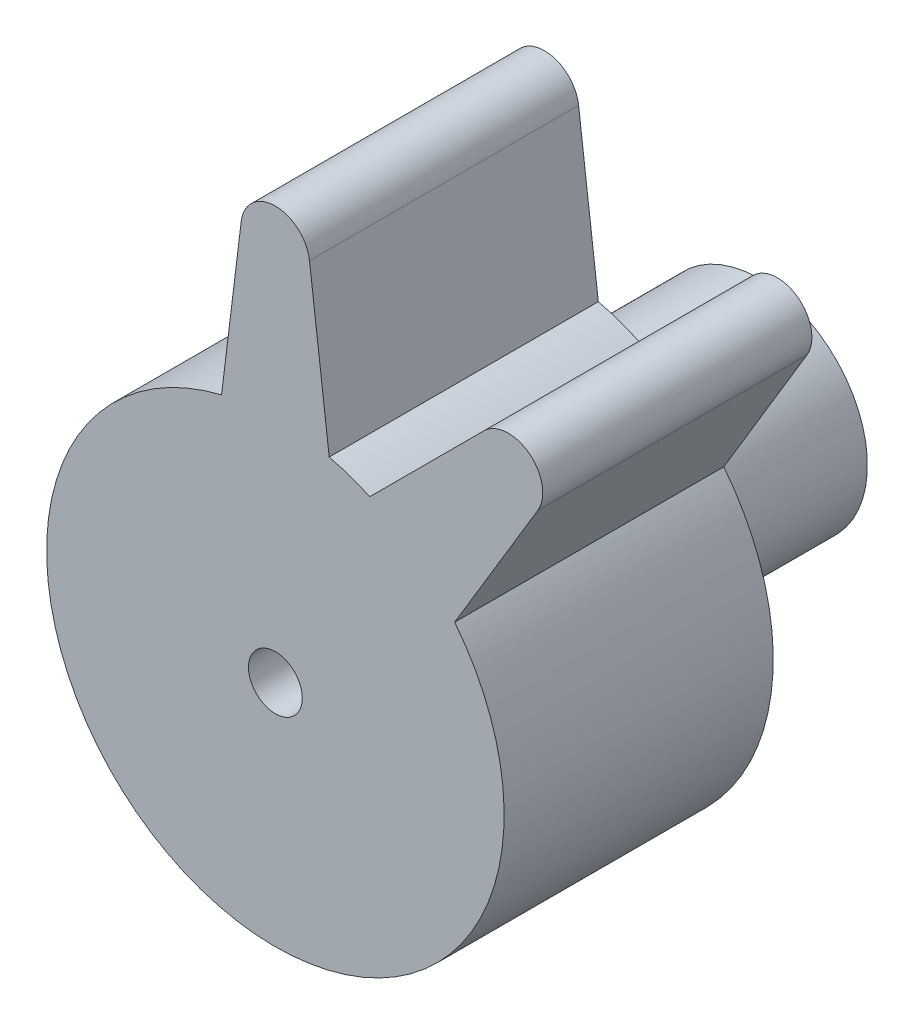
from build123d import *

# Parameters (mm, degrees)
SKETCH1_R           = 1
BOSS_EXTRUDE1_DEPTH = 10
BOSS_EXTRUDE3_DEPTH = 8


with BuildPart() as part:
    # Sketch1 → Boss-Extrude1 (new body)
    with BuildSketch(Plane.XY):
        with BuildLine():
            Line((-1.26878394, 14.216632731), (-2, 8.261355821))
            ThreePointArc((-2, 8.261355821), (-2.767329313, -8.036907893), (6.66222002, 5.278714276))
            Line((6.66222002, 5.278714276), (9.75244847, 10.42171808))
            ThreePointArc((9.75244847, 10.42171808), (9.443728606, 12.087421406), (7.752817693, 11.984000864))
            Line((7.752817693, 11.984000864), (3.510177006, 7.741360177))
            ThreePointArc((3.510177006, 7.741360177), (2.767329313, 8.036907893), (2, 8.261355821))
            Line((2, 8.261355821), (1.26878394, 14.216632731))
            ThreePointArc((1.26878394, 14.216632731), (0, 15.339157937), (-1.26878394, 14.216632731))
        make_face()
        Circle(SKETCH1_R, mode=Mode.SUBTRACT)
    extrude(amount=BOSS_EXTRUDE1_DEPTH)

    # Sketch5 → Boss-Extrude3 (add)
    with BuildSketch(Plane(origin=(0, 0, 0), x_dir=(-1, 0, 0), z_dir=(0, 0, -1))):
        with BuildLine():
            ThreePointArc((3.708099244, 1.5), (-4, 0), (3.708099244, -1.5))
            Line((3.708099244, -1.5), (3.708099244, 1.5))
        make_face()
        with BuildLine():
            Line((1.322875656, 1.5), (1.322875656, -1.5))
            ThreePointArc((1.322875656, -1.5), (-2, 0), (1.322875656, 1.5))
        make_face(mode=Mode.SUBTRACT)
    extrude(amount=BOSS_EXTRUDE3_DEPTH)


solid = part.part
